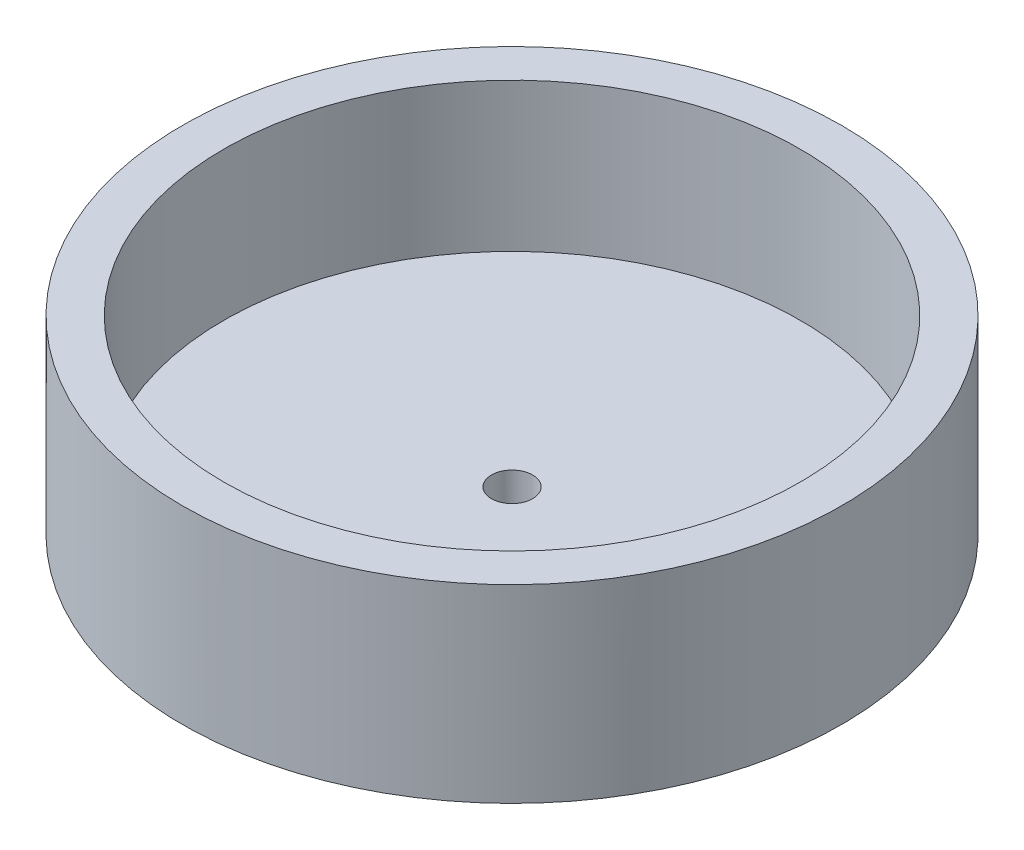
from build123d import *

# Parameters (mm, degrees)
ESQUISSE1_R             = 40
BOSS_EXTRU_2_DEPTH      = 35
ESQUISSE4_R             = 35
ENL_V_MAT_EXTRU_2_DEPTH = 18
ESQUISSE6_R             = 2.5
ENL_V_MAT_EXTRU_4_DEPTH = 12
ESQUISSE5_R             = 40
ENL_V_MAT_EXTRU_5_DEPTH = 12


with BuildPart() as part:
    # Esquisse1 → Boss.-Extru.2 (new body)
    with BuildSketch(Plane(origin=(0, 0, 0), x_dir=(1, 0, 0), z_dir=(0, 1, 0))):
        Circle(ESQUISSE1_R)
    extrude(amount=BOSS_EXTRU_2_DEPTH)

    # Esquisse4 → Enlèv. mat.-Extru.2 (cut)
    with BuildSketch(Plane(origin=(0, 35, 0), x_dir=(1, 0, 0), z_dir=(0, 1, 0))):
        Circle(ESQUISSE4_R)
    extrude(amount=-ENL_V_MAT_EXTRU_2_DEPTH, mode=Mode.SUBTRACT)

    # Esquisse6 → Enlèv. mat.-Extru.4 (cut)
    with BuildSketch(Plane(origin=(0, 17, 0), x_dir=(1, 0, 0), z_dir=(0, 1, 0))):
        Circle(ESQUISSE6_R)
    extrude(amount=-ENL_V_MAT_EXTRU_4_DEPTH, mode=Mode.SUBTRACT)

    # Esquisse5 → Enlèv. mat.-Extru.5 (cut)
    with BuildSketch(Plane(origin=(0, 0, 0), x_dir=(-1, 0, 0), z_dir=(0, -1, 0))):
        Circle(ESQUISSE5_R)
    extrude(amount=-ENL_V_MAT_EXTRU_5_DEPTH, mode=Mode.SUBTRACT)


solid = part.part
